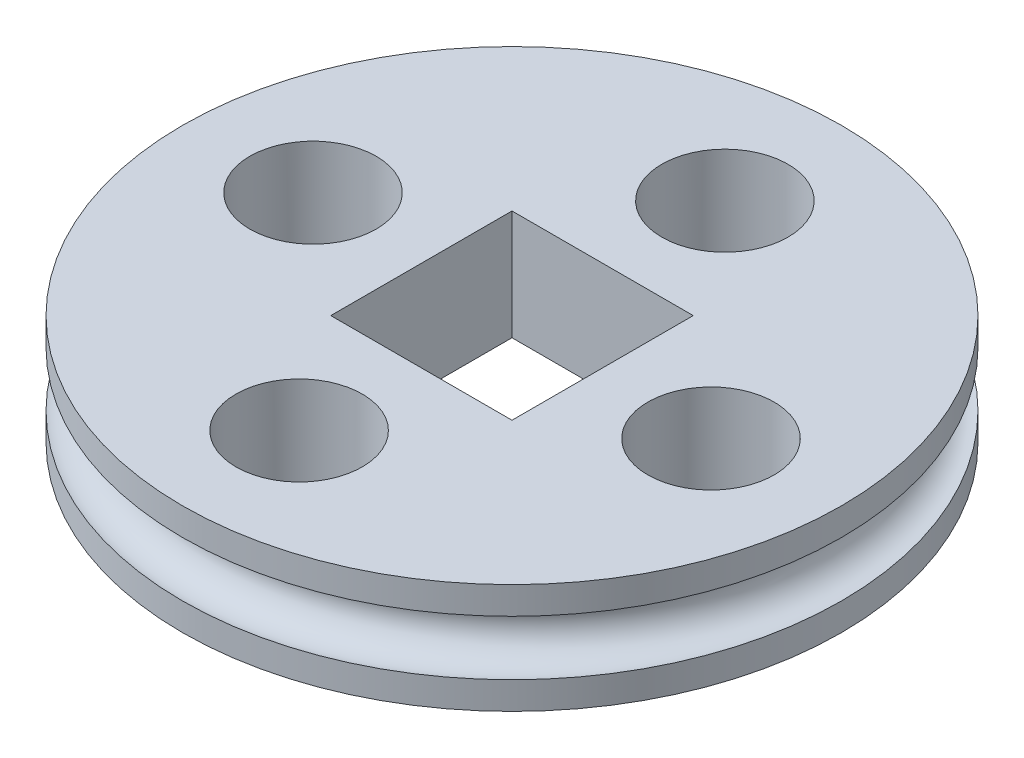
from build123d import *

# Parameters (mm, degrees)
SKIZZE1_R                       = 6
AUFSATZ_LINEAR_AUSTRAGEN1_DEPTH = 2
SKIZZE3_W                       = 3.3
SKIZZE3_H                       = 3.3
SCHNITT_LINEAR_AUSTRAGEN1_DEPTH = 3
SKIZZE4_R                       = 1.15
SCHNITT_LINEAR_AUSTRAGEN2_DEPTH = 3
KREISMUSTER1_COUNT              = 4


with BuildPart() as part:
    # Skizze1 → Aufsatz-Linear austragen1 (new body)
    with BuildSketch(Plane(origin=(0, 0, 0), x_dir=(1, 0, 0), z_dir=(0, 1, 0))):
        Circle(SKIZZE1_R)
    extrude(amount=AUFSATZ_LINEAR_AUSTRAGEN1_DEPTH)

    # Skizze3 → Schnitt-Linear austragen1 (cut)
    with BuildSketch(Plane(origin=(0, 2, 0), x_dir=(1, 0, 0), z_dir=(0, 1, 0))):
        Rectangle(SKIZZE3_W, SKIZZE3_H)
    extrude(amount=-SCHNITT_LINEAR_AUSTRAGEN1_DEPTH, mode=Mode.SUBTRACT)

    # Skizze4 → Schnitt-Linear austragen2 (cut)
    with BuildSketch(Plane(origin=(0, 2, 0), x_dir=(1, 0, 0), z_dir=(0, 1, 0))):
        with Locations((3.75, -0.126446108)):
            Circle(SKIZZE4_R)
    schnitt_linear_austragen2 = extrude(amount=-SCHNITT_LINEAR_AUSTRAGEN2_DEPTH, mode=Mode.SUBTRACT)

    # Kreismuster1: Schnitt-Linear austragen2 ×4 about axis
    kreismuster1_axis = Axis((0, 2, 0), (0, -1, 0))
    for i in range(1, KREISMUSTER1_COUNT):
        add(schnitt_linear_austragen2.rotate(kreismuster1_axis, i * 360 / KREISMUSTER1_COUNT), mode=Mode.SUBTRACT)

    # Skizze6 → Schnitt-Rotation2 (revolve, cut)
    with BuildSketch(Plane.XY):
        with BuildLine():
            Line((-6, 1.5), (-6, 0.5))
            ThreePointArc((-6, 0.5), (-5.384840005, 1), (-6, 1.5))
        make_face()
    revolve(axis=Axis((0, 2, 0), (0, -1, 0)), mode=Mode.SUBTRACT)


solid = part.part
